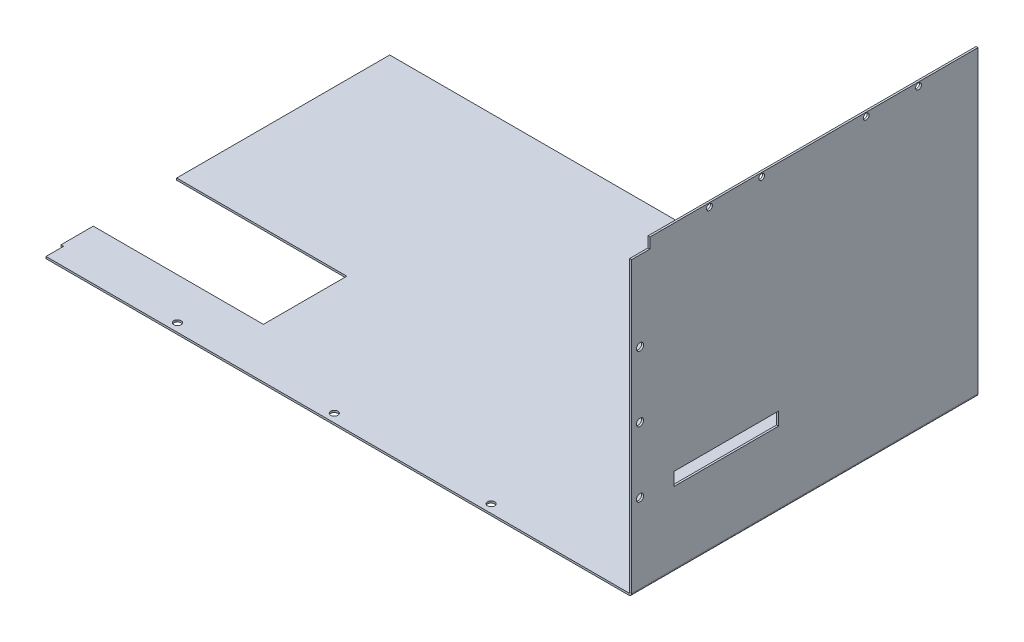
from build123d import *

# Parameters (mm, degrees)
SKETCH_2_W                       = 1.5
SKETCH_2_H                       = 231.5
SM_BASE_FLANGE_1_DEPTH           = 265
SKETCH_3_W                       = 2.488275725
SKETCH_3_H                       = 14
CUT_EXTRUDE_1_DEPTH              = 8
SKETCH_4_W                       = 80
SKETCH_4_H                       = 10
CUT_EXTRUDE_2_DEPTH              = 6
SM_EDGE_FLANGE_1_STRIP_W         = 7.4732
SM_EDGE_FLANGE_1_STRIP_H         = 1.5
SM_EDGE_FLANGE_1_STRIP_CUT_DEPTH = 265
SM_EDGE_FLANGE_1_DEPTH           = 265
SKETCH_10_W                      = 163
SKETCH_10_H                      = 1.5
EXTRUDE_1_DEPTH                  = 130.17
SKETCH_11_W                      = 38.16564302
SKETCH_11_H                      = 1.5
EXTRUDE_2_DEPTH                  = 130.17
SKETCH_12_R                      = 2.75
CUT_EXTRUDE_3_DEPTH              = 20
SKETCH_13_R                      = 2.75
CUT_EXTRUDE_4_DEPTH              = 10
SKETCH_14_W                      = 13.490100929
SKETCH_14_H                      = 1.5
CUT_EXTRUDE_5_DEPTH              = 2
SKETCH_15_R                      = 2.25
CUT_EXTRUDE_6_DEPTH              = 10


# Sheet-metal steps are written as plain solids
with BuildPart() as part:
    # Sketch 2 → 基体-法兰1 (new body)
    with BuildSketch(Plane.XY):
        with Locations((0.75, 115.75)):
            Rectangle(SKETCH_2_W, SKETCH_2_H)
    extrude(amount=SM_BASE_FLANGE_1_DEPTH)

    # 草图3 → 切除-拉伸1 (cut)
    with BuildSketch(Plane(origin=(0, 231.5, 0), x_dir=(1, 0, 0), z_dir=(0, 1, 0))):
        with Locations((1.244137863, -258)):
            Rectangle(SKETCH_3_W, SKETCH_3_H)
    extrude(amount=-CUT_EXTRUDE_1_DEPTH, mode=Mode.SUBTRACT)

    # 草图4 → 切除-拉伸2 (cut)
    with BuildSketch(Plane.ZY):
        with Locations((192.56107144, 61.95061584)):
            Rectangle(SKETCH_4_W, SKETCH_4_H)
    extrude(amount=-CUT_EXTRUDE_2_DEPTH, mode=Mode.SUBTRACT)

    # 边线-法兰1 strip (across the edge) → 边线-法兰1 strip cut (cut)
    with BuildSketch(Plane(origin=(0, 0, 0), x_dir=(0, 1, 0), z_dir=(0, 0, 1))):
        with Locations((-1.5, -0.75)):
            Rectangle(SM_EDGE_FLANGE_1_STRIP_W, SM_EDGE_FLANGE_1_STRIP_H)
    extrude(amount=SM_EDGE_FLANGE_1_STRIP_CUT_DEPTH, mode=Mode.SUBTRACT)

    # 边线-法兰1 section (across the edge) → 边线-法兰1 (add)
    with BuildSketch(Plane(origin=(0, 0, 0), x_dir=(0, 1, 0), z_dir=(0, 0, 1))):
        with BuildLine():
            Line((0, 0.7366), (0, 318.5))
            Line((0, 318.5), (1.5, 318.5))
            Line((1.5, 318.5), (1.5, 0.7366))
            ThreePointArc((1.5, 0.7366), (1.715745145, 0.215745145), (2.2366, 0))
            Line((2.2366, 0), (2.2366, -1.5))
            ThreePointArc((2.2366, -1.5), (0.655084973, -0.844915027), (0, 0.7366))
        make_face()
    extrude(amount=SM_EDGE_FLANGE_1_DEPTH)

    # 草图10 → 凸台-拉伸1 (add)
    with BuildSketch(Plane.ZY.offset(318.5)):
        with Locations((81.5, 0.75)):
            Rectangle(SKETCH_10_W, SKETCH_10_H)
    extrude(amount=EXTRUDE_1_DEPTH)

    # 草图11 → 凸台-拉伸2 (add)
    with BuildSketch(Plane.ZY.offset(318.5)):
        with Locations((245.91717849, 0.75)):
            Rectangle(SKETCH_11_W, SKETCH_11_H)
    extrude(amount=EXTRUDE_2_DEPTH)

    # 草图12 → 切除-拉伸3 (cut)
    with BuildSketch(Plane(origin=(1.5, 0, 0), x_dir=(0, 0, -1), z_dir=(1, 0, 0))):
        with Locations((-258.6183, 162.5)):
            Circle(SKETCH_12_R)
        with Locations((-258.6183, 112.5)):
            Circle(SKETCH_12_R)
        with Locations((-258.6183, 62.5)):
            Circle(SKETCH_12_R)
    extrude(amount=-CUT_EXTRUDE_3_DEPTH, mode=Mode.SUBTRACT)

    # 草图13 → 切除-拉伸4 (cut)
    with BuildSketch(Plane.XZ):
        with Locations((-352.4684, 258.6183)):
            Circle(SKETCH_13_R)
        with Locations((-232.4684, 258.6183)):
            Circle(SKETCH_13_R)
        with Locations((-112.4684, 258.6183)):
            Circle(SKETCH_13_R)
    extrude(amount=-CUT_EXTRUDE_4_DEPTH, mode=Mode.SUBTRACT)

    # 草图14 → 切除-拉伸5 (cut)
    with BuildSketch(Plane.ZY.offset(448.67)):
        with Locations((258.254949536, 0.75)):
            Rectangle(SKETCH_14_W, SKETCH_14_H)
    extrude(amount=-CUT_EXTRUDE_5_DEPTH, mode=Mode.SUBTRACT)

    # 草图15 → 切除-拉伸6 (cut)
    with BuildSketch(Plane(origin=(1.5, 0, 0), x_dir=(0, 0, -1), z_dir=(1, 0, 0))):
        with Locations((-45.5, 228.5)):
            Circle(SKETCH_15_R)
        with Locations((-85.5, 228.5)):
            Circle(SKETCH_15_R)
        with Locations(Location((-205.5, 228.5, 0), (0, 0, 180))):
            Circle(SKETCH_15_R)
        with Locations(Location((-165.5, 228.5, 0), (0, 0, 180))):
            Circle(SKETCH_15_R)
    extrude(amount=-CUT_EXTRUDE_6_DEPTH, mode=Mode.SUBTRACT)


solid = part.part
